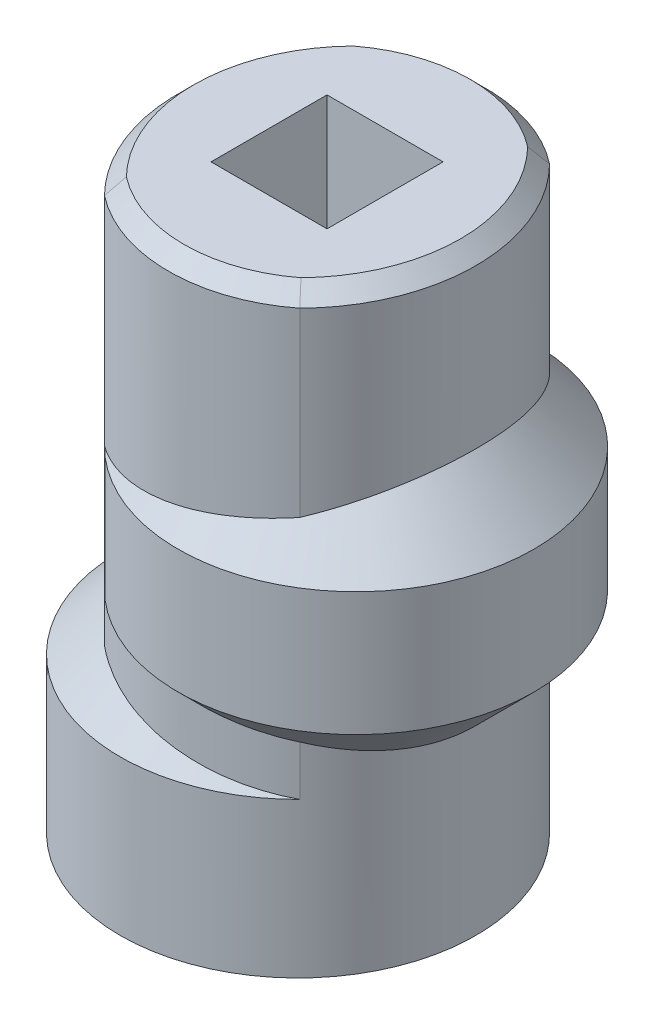
from build123d import *

# Parameters (mm, degrees)
BOSS_EXTRUDE1_DEPTH = 15.4
CUT_EXTRUDE1_DEPTH  = 9.4
CUT_EXTRUDE2_REACH  = 18.939
SKETCH5_W           = 3
SKETCH5_H           = 3
CHAMFER1_SIZE       = 0.4


with BuildPart() as part:
    # Sketch1 → Boss-Extrude1 (new body)
    with BuildSketch(Plane(origin=(0, 0, 0), x_dir=(1, 0, 0), z_dir=(0, 1, 0))):
        with BuildLine():
            ThreePointArc((-2.525, -3.23022832), (0, -4.1), (2.525, -3.23022832))
            ThreePointArc((2.525, -3.23022832), (3.85, 0), (2.525, 3.23022832))
            ThreePointArc((2.525, 3.23022832), (0, 4.1), (-2.525, 3.23022832))
            ThreePointArc((-2.525, 3.23022832), (-3.85, 0), (-2.525, -3.23022832))
        make_face()
    extrude(amount=BOSS_EXTRUDE1_DEPTH)

    # Sketch2 → Revolve1 (revolve)
    with BuildSketch(Plane.XY, mode=Mode.PRIVATE) as revolve1_sk:
        Polygon((3.85, 0), (3.85, 4), (2.35, 5.5), (-0.75, 5.5), (-0.75, 0), align=None)
    revolve(revolve1_sk.sketch.rotate(Axis((-0.75, 5.5, 0), (0, -1, 0)), 270), axis=Axis((-0.75, 5.5, 0), (0, -1, 0)))

    # Sketch3 → Revolve2 (revolve)
    with BuildSketch(Plane.XY, mode=Mode.PRIVATE) as revolve2_sk:
        Polygon((0.75, 4.7), (-2.35, 4.7), (-3.85, 6.2), (-3.85, 9.4), (-2.35, 10.9), (0.75, 10.9), align=None)
    revolve(revolve2_sk.sketch.rotate(Axis((0.75, 4.7, 0), (0, 1, 0)), 315.394327097), axis=Axis((0.75, 4.7, 0), (0, 1, 0)))

    # Sketch4 → Cut-Extrude1 (cut)
    with BuildSketch(Plane.XZ):
        with BuildLine():
            Line((-2, -2), (2, -2))
            ThreePointArc((2, -2), (2.465465068, -1.682598659), (2.339973189, -1.133369081))
            ThreePointArc((2.339973189, -1.133369081), (0, 2.6), (-2.339973189, -1.133369081))
            ThreePointArc((-2.339973189, -1.133369081), (-2.465465068, -1.682598659), (-2, -2))
        make_face()
    extrude(amount=-CUT_EXTRUDE1_DEPTH, mode=Mode.SUBTRACT)

    # Sketch5 → Cut-Extrude2 (cut, up to next)
    with BuildSketch(Plane(origin=(0, 15.4, 0), x_dir=(1, 0, 0), z_dir=(0, 1, 0)), mode=Mode.PRIVATE) as cut_extrude2_sk1:
        Rectangle(SKETCH5_W, SKETCH5_H)
    cut_extrude2_tool1 = extrude(cut_extrude2_sk1.sketch, amount=-CUT_EXTRUDE2_REACH, mode=Mode.PRIVATE) & part.part
    add(cut_extrude2_tool1.solids().sort_by_distance((0, 15.4, 0))[0], mode=Mode.SUBTRACT)

    # Chamfer1
    # the kernel refuses this chamfer: 0.4 mm, written as the material it takes off along each edge
    with BuildSketch(Plane(origin=(0, 15.4, 0), x_dir=(-0.7922190522423981, 0, 0.6102368173620439), z_dir=(-0.6102368173620439, 0, -0.7922190522423981))) as chamfer1_piece_1:
        Polygon((4.1 - CHAMFER1_SIZE, 0), (4.1, -CHAMFER1_SIZE), (4.1, 0), align=None)
    revolve(axis=Axis((0, 15.4, 0), (0, 1, 0)), revolution_arc=104.786743256, mode=Mode.SUBTRACT)
    with BuildSketch(Plane(origin=(-0.75, 15.4, 0), x_dir=(0.5384255548923128, 0, 0.8426730812354843), z_dir=(-0.8426730812354843, 0, 0.5384255548923128))) as chamfer1_piece_2:
        Polygon((4.6 - CHAMFER1_SIZE, 0), (4.6, -CHAMFER1_SIZE), (4.6, 0), align=None)
    revolve(axis=Axis((-0.75, 15.4, 0), (0, 1, 0)), revolution_arc=114.846952535, mode=Mode.SUBTRACT)
    with BuildSketch(Plane(origin=(0, 15.4, 0), x_dir=(0.7922190522423987, 0, -0.610236817362043), z_dir=(0.610236817362043, 0, 0.7922190522423987))) as chamfer1_piece_3:
        Polygon((4.1 - CHAMFER1_SIZE, 0), (4.1, -CHAMFER1_SIZE), (4.1, 0), align=None)
    revolve(axis=Axis((0, 15.4, 0), (0, 1, 0)), revolution_arc=104.786743256, mode=Mode.SUBTRACT)
    with BuildSketch(Plane(origin=(0.75, 15.4, 0), x_dir=(-0.5384255548923127, 0, -0.8426730812354845), z_dir=(0.8426730812354845, 0, -0.5384255548923127))) as chamfer1_piece_4:
        Polygon((4.6 - CHAMFER1_SIZE, 0), (4.6, -CHAMFER1_SIZE), (4.6, 0), align=None)
    revolve(axis=Axis((0.75, 15.4, 0), (0, 1, 0)), revolution_arc=114.846952535, mode=Mode.SUBTRACT)


solid = part.part
